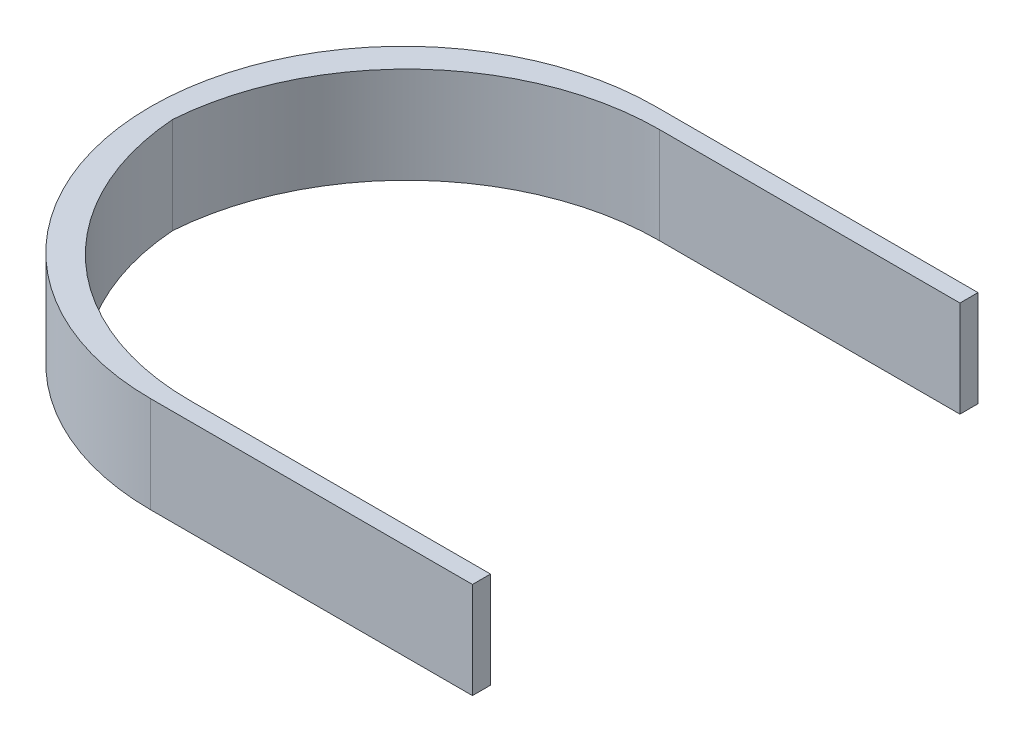
from build123d import *

# Parameters (mm, degrees)
CROQUIS3_W                 = 50
CROQUIS3_H                 = 42
SALIENTE_EXTRUIR7_DEPTH    = 8
CORTAR_EXTRUIR2_DEPTH      = 8
CORTAR_EXTRUIR2_DEPTH_BACK = 8
CROQUIS3_13_W              = 46.428571428
CROQUIS3_13_H              = 39
REDONDEO3_R                = 21
CROQUIS7_W                 = 3.39365255
CROQUIS7_H                 = 46.015277421
CORTAR_EXTRUIR3_DEPTH      = 8


with BuildPart() as part:
    # Croquis3 → Saliente-Extruir7 (new body)
    with BuildSketch(Plane(origin=(0, 0, 0), x_dir=(1, 0, 0), z_dir=(0, 1, 0))):
        with Locations((25, 21)):
            Rectangle(CROQUIS3_W, CROQUIS3_H)
    extrude(amount=SALIENTE_EXTRUIR7_DEPTH)

    # Croquis3<13> → Cortar-Extruir2 (cut, two sides: drawn at the far end of the back side and taken through both)
    with BuildSketch(Plane(origin=(0, 0, 0), x_dir=(1, 0, 0), z_dir=(0, 1, 0)).offset(-CORTAR_EXTRUIR2_DEPTH_BACK)):
        with Locations((25, 21)):
            Rectangle(CROQUIS3_13_W, CROQUIS3_13_H)
    extrude(amount=CORTAR_EXTRUIR2_DEPTH + CORTAR_EXTRUIR2_DEPTH_BACK, mode=Mode.SUBTRACT)

    # Redondeo3
    # the kernel refuses this fillet: 21 mm, written as the material it adds along each edge
    with BuildSketch(Plane(origin=(1.785714286, 0, -1.5), x_dir=(0, 0, -1), z_dir=(0, 1, 0)), Plane(origin=(1.785714286, 0, -40.5), x_dir=(1, 0, 0), z_dir=(0, 1, 0))) as redondeo3_piece_1:
        with BuildLine():
            CenterArc((REDONDEO3_R, -REDONDEO3_R), REDONDEO3_R, 90, 90)
            Line((0, -REDONDEO3_R), (0, 0))
            Line((0, 0), (REDONDEO3_R, 0))
        make_face()
    extrude(amount=8)
    # the kernel refuses this fillet: 21 mm, written as the material it takes off along each edge
    with BuildSketch(Plane(origin=(0, -52.5, 0), x_dir=(1, 0, 0), z_dir=(0, 1, 0)), Plane(origin=(0, -52.5, -42), x_dir=(0, 0, 1), z_dir=(0, 1, 0))) as redondeo3_2_piece_1:
        with BuildLine():
            CenterArc((REDONDEO3_R, REDONDEO3_R), REDONDEO3_R, 180, 90)
            Line((0, REDONDEO3_R), (0, 0))
            Line((0, 0), (REDONDEO3_R, 0))
        make_face()
    extrude(amount=113, mode=Mode.SUBTRACT)

    # Croquis7 → Cortar-Extruir3 (cut)
    with BuildSketch(Plane(origin=(0, 8, 0), x_dir=(1, 0, 0), z_dir=(0, 1, 0))):
        with Locations((49.446476979, 20.219134687)):
            Rectangle(CROQUIS7_W, CROQUIS7_H)
    extrude(amount=-CORTAR_EXTRUIR3_DEPTH, mode=Mode.SUBTRACT)


solid = part.part
